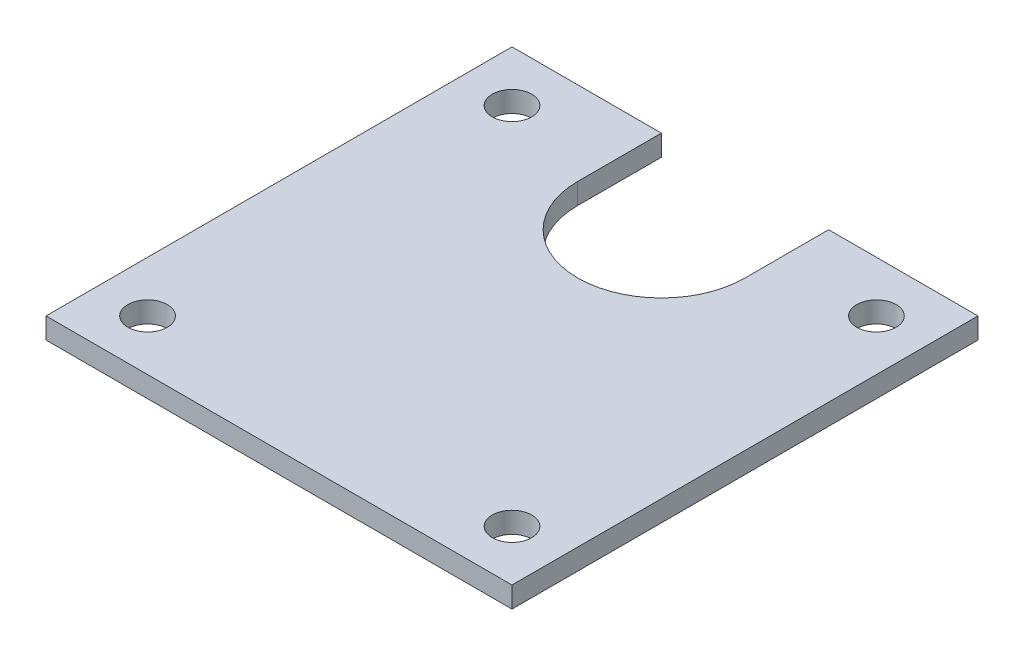
from build123d import *

# Parameters (mm, degrees)
SKETCH1_W        = 39
SKETCH1_H        = 39
SKETCH1_R        = 1.65
SHAPE_DEPTH      = 1.75
CAMERA_CUT_REACH = 29.633


with BuildPart() as part:
    # Sketch1 → Shape (new body)
    with BuildSketch(Plane(origin=(0, 0, 0), x_dir=(1, 0, 0), z_dir=(0, 1, 0))):
        Rectangle(SKETCH1_W, SKETCH1_H)
        with Locations((-15.25, 15.25)):
            Circle(SKETCH1_R, mode=Mode.SUBTRACT)
        with Locations((15.25, 15.25)):
            Circle(SKETCH1_R, mode=Mode.SUBTRACT)
        with Locations((-15.25, -15.25)):
            Circle(SKETCH1_R, mode=Mode.SUBTRACT)
        with Locations((15.25, -15.25)):
            Circle(SKETCH1_R, mode=Mode.SUBTRACT)
    extrude(amount=SHAPE_DEPTH)

    # Sketch2 → Camera cut (cut, up to next)
    with BuildSketch(Plane(origin=(0, 1.75, 0), x_dir=(1, 0, 0), z_dir=(0, 1, 0)), mode=Mode.PRIVATE) as camera_cut_sk1:
        with BuildLine():
            Line((7, 12.5), (7, 19.5))
            Line((7, 19.5), (-7, 19.5))
            Line((-7, 19.5), (-7, 12.5))
            ThreePointArc((-7, 12.5), (0, 5.5), (7, 12.5))
        make_face()
    camera_cut_tool1 = extrude(camera_cut_sk1.sketch, amount=-CAMERA_CUT_REACH, mode=Mode.PRIVATE) & part.part
    add(camera_cut_tool1.solids().sort_by_distance((0, 1.75, -13.153449))[0], mode=Mode.SUBTRACT)


solid = part.part
